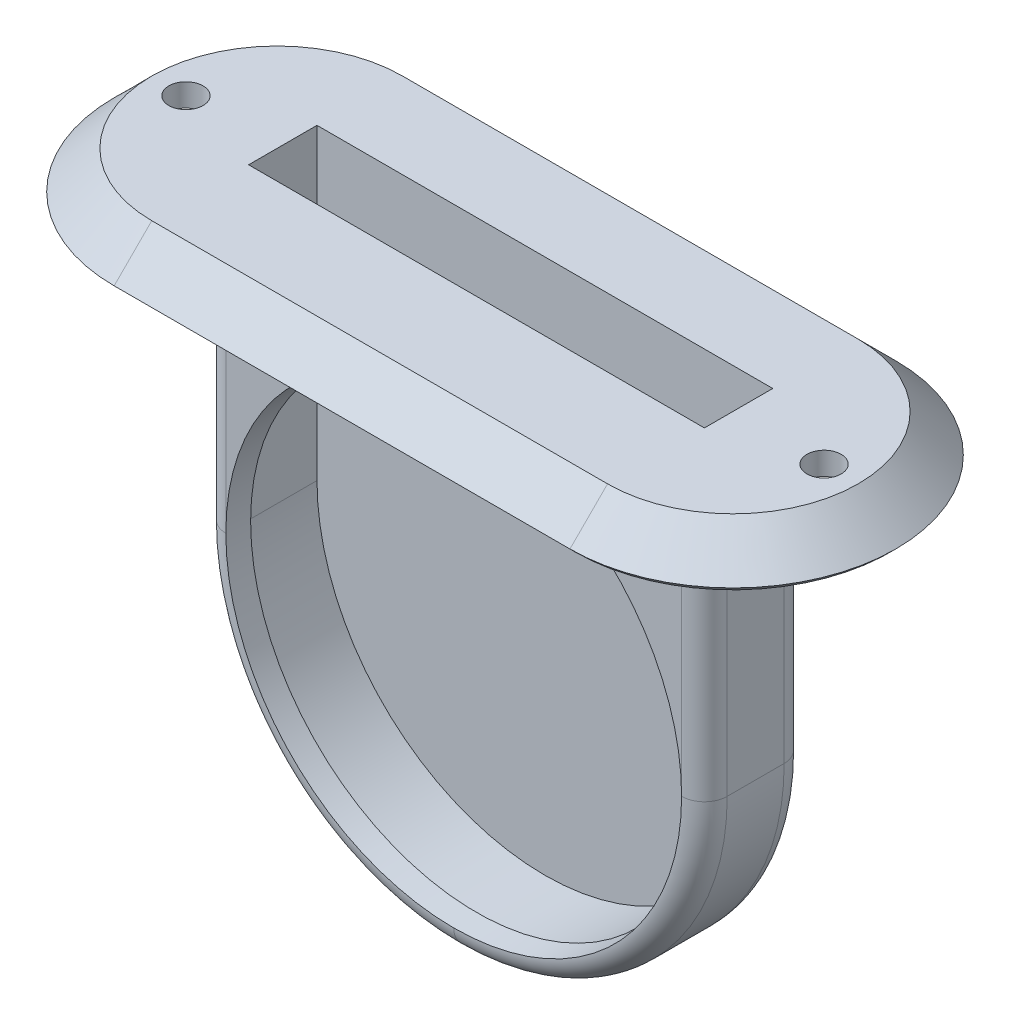
from build123d import *
from OCP.BRepFilletAPI import BRepFilletAPI_MakeChamfer

# Parameters (mm, degrees)
BOSS_EXTRU_1_DEPTH      = 3.8
BOSS_EXTRU_1_TAPER      = 45
COQUE2_DEPTH            = 1.8
COQUE2_DRAFT            = 45
CHANFREIN1_SIZE         = 1
CHANFREIN1_SIZE2        = 0.707106781
ENL_V_MAT_EXTRU_1_REACH = 39.355
ESQUISSE2_R             = 1.5
ESQUISSE3_W             = 44
ESQUISSE3_H             = 9
BOSS_EXTRU_4_DEPTH      = 47
CONG_1_R                = 22
CONG_2_R                = 2
ESQUISSE7_R             = 20
ENL_V_MAT_EXTRU_4_DEPTH = 2
ENL_V_MAT_EXTRU_4_DRAFT = -5
ENL_V_MAT_EXTRU_5_DEPTH = 6


# Read off the part's stored shape, not the designer's step: Coque2
with BuildPart() as part:
    # Esquisse1 → Boss.-Extru.1 (new body)
    with BuildSketch(Plane(origin=(0, 0, 0), x_dir=(1, 0, 0), z_dir=(0, 1, 0))):
        with BuildLine():
            ThreePointArc((-20, 14.8), (-34.8, 0), (-20, -14.8))
            Line((-20, -14.8), (20, -14.8))
            ThreePointArc((20, -14.8), (34.8, 0), (20, 14.8))
            Line((20, 14.8), (-20, 14.8))
        make_face()
    extrude(amount=BOSS_EXTRU_1_DEPTH, taper=BOSS_EXTRU_1_TAPER)


with BuildPart() as coque2_tool:
    # Coque2 outline → Coque2 (with draft: the straight prism first)
    with BuildSketch(Plane(origin=(0, 1.8, 0), x_dir=(1, 0, 0), z_dir=(0, 1, 0))):
        with BuildLine():
            Line((-20, -10.171572875), (20, -10.171572875))
            ThreePointArc((20, -10.171572875), (30.171572875, 0), (20, 10.171572875))
            Line((20, 10.171572875), (-20, 10.171572875))
            ThreePointArc((-20, 10.171572875), (-30.171572875, 0), (-20, -10.171572875))
        make_face()
    extrude(amount=-COQUE2_DEPTH)
    # Coque2: the draft: its side faces are tilted about the plane it starts from
    coque2_sides = [coque2_tool.faces().sort_by_distance(p)[0] for p in [
        (0, 0.9, 10.171572875),
        (30.171572875, 0.9, 0),
        (0, 0.9, -10.171572875),
        (-30.171572875, 0.9, 0),
    ]]
    draft(coque2_sides, Plane(origin=(0, 1.8, 0), x_dir=(1, 0, 0), z_dir=(0, 1, 0)), COQUE2_DRAFT)


with BuildPart() as part_1:
    add(part.part)

    # Coque2: cut by coque2_tool
    add(coque2_tool.part, mode=Mode.SUBTRACT)

    # Chanfrein1: one chamfer whose edges measure the first distance from different faces: ONE call of the kernel's chamfer builder (chamfer() names one face for all edges)
    chanfrein1_edges_1 = [part_1.edges().sort_by_distance(p)[0] for p in [
        (0, 0, -14.8),
        (0, 0, 14.8),
        (-34.8, 0, 0),
    ]]
    chanfrein1_side_1 = [part_1.faces().sort_by_distance(p)[0] for p in [
        (0, 0, -14.043672029),
    ]]
    chanfrein1_edges_2 = [part_1.edges().sort_by_distance(p)[0] for p in [
        (34.8, 0, 0),
    ]]
    chanfrein1_side_2 = [part_1.faces().sort_by_distance(p)[0] for p in [
        (32.9, 1.9, 0),
    ]]
    chanfrein1 = BRepFilletAPI_MakeChamfer(part_1.part.solid().wrapped)
    for e in chanfrein1_edges_1:
        chanfrein1.Add(CHANFREIN1_SIZE, CHANFREIN1_SIZE2, e.wrapped, chanfrein1_side_1[0].wrapped)  # the first distance lies on this face
    for e in chanfrein1_edges_2:
        chanfrein1.Add(CHANFREIN1_SIZE, CHANFREIN1_SIZE2, e.wrapped, chanfrein1_side_2[0].wrapped)  # the first distance lies on this face
    add(Compound.cast(chanfrein1.Shape()), mode=Mode.REPLACE)

    # Esquisse2 → Enlèv. mat.-Extru.1 (cut, up to next)
    with BuildSketch(Plane(origin=(0, 3.8, 0), x_dir=(1, 0, 0), z_dir=(0, 1, 0)), mode=Mode.PRIVATE) as enl_v_mat_extru_1_sk1:
        with Locations(Location((-28, 0, 0), (0, 0, 270))):
            Circle(ESQUISSE2_R)
    enl_v_mat_extru_1_tool1 = extrude(enl_v_mat_extru_1_sk1.sketch, amount=-ENL_V_MAT_EXTRU_1_REACH, mode=Mode.PRIVATE) & part_1.part
    # Esquisse2 → Enlèv. mat.-Extru.1 (cut, up to next)
    with BuildSketch(Plane(origin=(0, 3.8, 0), x_dir=(1, 0, 0), z_dir=(0, 1, 0)), mode=Mode.PRIVATE) as enl_v_mat_extru_1_sk2:
        with Locations(Location((28, 0, 0), (0, 0, 270))):
            Circle(ESQUISSE2_R)
    enl_v_mat_extru_1_tool2 = extrude(enl_v_mat_extru_1_sk2.sketch, amount=-ENL_V_MAT_EXTRU_1_REACH, mode=Mode.PRIVATE) & part_1.part
    add(enl_v_mat_extru_1_tool1.solids().sort_by_distance((-28, 3.8, 0))[0], mode=Mode.SUBTRACT)
    add(enl_v_mat_extru_1_tool2.solids().sort_by_distance((28, 3.8, 0))[0], mode=Mode.SUBTRACT)

    # Esquisse3 → Boss.-Extru.4 (add)
    with BuildSketch(Plane.XZ.offset(-1.8)):
        Rectangle(ESQUISSE3_W, ESQUISSE3_H)
    extrude(amount=BOSS_EXTRU_4_DEPTH)

    # Congé1
    cong_1_edges = [part_1.edges().sort_by_distance(p)[0] for p in [
        (22, -45.2, 0),
        (-22, -45.2, 0),
    ]]
    fillet(cong_1_edges, radius=CONG_1_R - 0.0001)  # a hair under: the kernel refuses the full size

    # Congé2
    cong_2_edges = [part_1.edges().sort_by_distance(p)[0] for p in [
        (-22, -10.70005, 4.5),
        (22, -10.70005, 4.5),
        (-15.556378475, -38.756378475, 4.5),
        (15.556378475, -38.756378475, 4.5),
        (22, -10.70005, -4.5),
        (-22, -10.70005, -4.5),
        (-15.556378475, -38.756378475, -4.5),
        (15.556378475, -38.756378475, -4.5),
    ]]
    fillet(cong_2_edges, radius=CONG_2_R)


with BuildPart() as enl_v_mat_extru_4_tool:
    # Esquisse7 → Enlèv. mat.-Extru.4 (with draft: the straight prism first)
    with BuildSketch(Plane.XY.offset(4.5)):
        with Locations((0, -23.2)):
            Circle(ESQUISSE7_R)
    extrude(amount=-ENL_V_MAT_EXTRU_4_DEPTH)
    # Enlèv. mat.-Extru.4: the draft: its side faces are tilted about the plane it starts from
    enl_v_mat_extru_4_sides = [enl_v_mat_extru_4_tool.faces().sort_by_distance(p)[0] for p in [
        (-20, -23.2, 3.5),
    ]]
    draft(enl_v_mat_extru_4_sides, Plane.XY.offset(4.5), ENL_V_MAT_EXTRU_4_DRAFT)


with BuildPart() as part_2:
    add(part_1.part)

    # Enlèv. mat.-Extru.4: cut by enl_v_mat_extru_4_tool
    add(enl_v_mat_extru_4_tool.part, mode=Mode.SUBTRACT)

    # Esquisse9 → Enlèv. mat.-Extru.5 (cut)
    with BuildSketch(Plane.XY.offset(2.5)):
        with BuildLine():
            Line((-20, -23.2), (-20, 3.8))
            Line((-20, 3.8), (20, 3.8))
            Line((20, 3.8), (20, -23.2))
            ThreePointArc((20, -23.2), (0, -43.2), (-20, -23.2))
        make_face()
    extrude(amount=-ENL_V_MAT_EXTRU_5_DEPTH, mode=Mode.SUBTRACT)


solid = part_2.part
